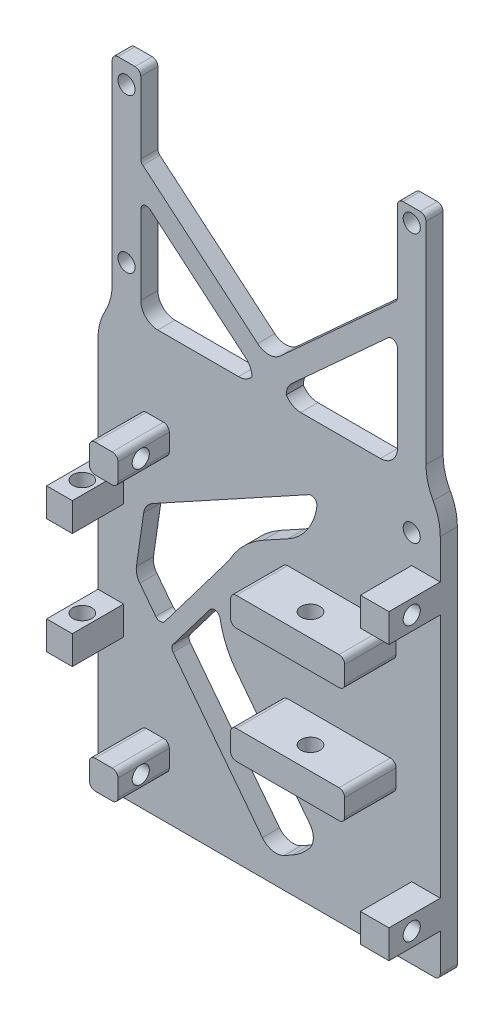
from build123d import *

# Parameters (mm, degrees)
SKETCH1_W           = 60
SKETCH1_H           = 74
BOSS_EXTRUDE1_DEPTH = 3
SKETCH2_W           = 4.5
SKETCH2_H           = 5
SKETCH2_W_2         = 20
SKETCH2_W_3         = 5
BOSS_EXTRUDE2_DEPTH = 9
SKETCH3_R           = 1.653641306
CUT_EXTRUDE1_DEPTH  = 26
SKETCH4_R           = 1.5
CUT_EXTRUDE2_DEPTH  = 59
SKETCH5_R           = 1.414139243
SKETCH5_W           = 5
SKETCH5_H           = 38
SKETCH5_R_2         = 1.5
SKETCH5_H_2         = 41
BOSS_EXTRUDE3_DEPTH = 3
SKETCH6_R           = 1.5
CUT_EXTRUDE3_DEPTH  = 3
BOSS_EXTRUDE4_DEPTH = 3
FILLET1_R           = 10
FILLET2_R           = 10
FILLET3_R           = 10
FILLET4_R           = 10
FILLET5_R           = 3
FILLET6_R           = 3
FILLET7_R           = 3
FILLET8_R           = 3
FILLET9_R           = 3
FILLET10_R          = 3
FILLET11_R          = 3
FILLET12_R          = 1
FILLET13_R          = 1
FILLET14_R          = 1
FILLET15_R          = 1
CUT_EXTRUDE4_DEPTH  = 3
FILLET16_R          = 15
FILLET17_R          = 10
FILLET18_R          = 10
FILLET19_R          = 3
FILLET20_R          = 3
FILLET21_R          = 3
FILLET22_R          = 3
FILLET23_R          = 1
FILLET24_R          = 1
FILLET25_R          = 1
FILLET26_R          = 1
FILLET27_R          = 1
FILLET28_R          = 1
FILLET29_R          = 1
BOSS_EXTRUDE5_START = -3
BOSS_EXTRUDE5_DEPTH = 3
FILLET30_R          = 1
FILLET31_R          = 1
FILLET32_R          = 1
FILLET33_R          = 1
FILLET34_R          = 1
FILLET35_R          = 1
FILLET36_R          = 1
FILLET37_R          = 1
FILLET38_R          = 1
FILLET39_R          = 1
FILLET40_R          = 1
FILLET41_R          = 1
FILLET42_R          = 1
FILLET43_R          = 1


# Some blends are built 0.0001 mm under size
with BuildPart() as part:
    # Sketch1 → Boss-Extrude1 (new body)
    with BuildSketch(Plane.XY):
        with Locations((-33.757062147, -1.04519774)):
            Rectangle(SKETCH1_W, SKETCH1_H)
    extrude(amount=BOSS_EXTRUDE1_DEPTH)

    # Sketch2 → Boss-Extrude2 (add)
    with BuildSketch(Plane.XY.offset(3)):
        with Locations((-61.507062147, 9.05480226)):
            Rectangle(SKETCH2_W, SKETCH2_H)
        with Locations((-61.507062147, -11.14519774)):
            Rectangle(SKETCH2_W, SKETCH2_H)
        with Locations((-21.507062147, -11.14519774)):
            Rectangle(SKETCH2_W_2, SKETCH2_H)
        with Locations((-21.507062147, 9.05480226)):
            Rectangle(SKETCH2_W_2, SKETCH2_H)
        with Locations((-53.757062147, -28.04519774)):
            Rectangle(SKETCH2_W_3, SKETCH2_H)
        with Locations((-53.757062147, 19.95480226)):
            Rectangle(SKETCH2_W_3, SKETCH2_H)
        with Locations((-6.257062147, -28.04519774)):
            Rectangle(SKETCH2_W_3, SKETCH2_H)
        with Locations((-6.257062147, 19.95480226)):
            Rectangle(SKETCH2_W_3, SKETCH2_H)
    extrude(amount=BOSS_EXTRUDE2_DEPTH)

    # Sketch3 → Cut-Extrude1 (cut)
    with BuildSketch(Plane.XZ.offset(13.64519774)):
        with Locations(Location((-21.507062147, 8, 0), (0, 0, 270))):
            Circle(SKETCH3_R)
        with Locations(Location((-61.507062147, 8, 0), (0, 0, 270))):
            Circle(SKETCH3_R)
    extrude(amount=-CUT_EXTRUDE1_DEPTH, mode=Mode.SUBTRACT)

    # Sketch4 → Cut-Extrude2 (cut)
    with BuildSketch(Plane.ZY.offset(56.257062147)):
        with Locations((8, 19.95480226)):
            Circle(SKETCH4_R)
        with Locations((8, -28.04519774)):
            Circle(SKETCH4_R)
    extrude(amount=-CUT_EXTRUDE2_DEPTH, mode=Mode.SUBTRACT)

    # Sketch5 → Boss-Extrude3 (add)
    # profile 1 of 3: a face of its own
    with BuildSketch(Plane.XY.offset(3)):
        with Locations((-8.757062147, 27.45480226)):
            Circle(SKETCH5_R)
    # profile 2 of 3: a face of its own
    with BuildSketch(Plane.XY.offset(3)):
        with Locations((-58.757062147, 54.95480226)):
            Rectangle(SKETCH5_W, SKETCH5_H)
        with Locations((-58.757062147, 70.45480226)):
            Circle(SKETCH5_R_2, mode=Mode.SUBTRACT)
        with Locations((-58.757062147, 43.45480226)):
            Circle(SKETCH5_R_2, mode=Mode.SUBTRACT)
    # profile 3 of 3: a face of its own
    with BuildSketch(Plane.XY.offset(3)):
        with Locations((-8.757062147, 56.45480226)):
            Rectangle(SKETCH5_W, SKETCH5_H_2)
        with Locations((-8.757062147, 74.45480226)):
            Circle(SKETCH5_R_2, mode=Mode.SUBTRACT)
    extrude(amount=-BOSS_EXTRUDE3_DEPTH)

    # Sketch6 → Cut-Extrude3 (cut)
    with BuildSketch(Plane.XY.offset(3)):
        with Locations((-8.757062147, 27.45480226)):
            Circle(SKETCH6_R)
    extrude(amount=-CUT_EXTRUDE3_DEPTH, mode=Mode.SUBTRACT)

    # Sketch7 → Boss-Extrude4 (add)
    with BuildSketch(Plane.XY.offset(3)):
        Polygon((-56.257062147, 54.95480226), (-36.757062147, 38.488135593), (-36.757062147, 35.95480226), (-30.757062147, 35.95480226), (-30.757062147, 38.688135593), (-11.257062147, 56.45480226), (-11.257062147, 61.45480226), (-33.757062147, 40.95480226), (-56.257062147, 59.95480226), align=None)
    extrude(amount=-BOSS_EXTRUDE4_DEPTH)

    # Fillet1
    # the kernel refuses this fillet: 10 mm, written as the material it takes off along each edge
    with BuildSketch(Plane(origin=(-3.757062147, 35.95480226, -16.535945694), x_dir=(0, -1, 0), z_dir=(0, 0, 1))) as fillet1_piece_1:
        with BuildLine():
            CenterArc((6.614378278, -10), FILLET1_R, 90, 41.409622109)
            Line((0, -2.5), (-0.132287566, -2.35))
            ThreePointArc((-0.132287566, -2.35), (-0.2, -1.25), (-0.2, 0))
            Line((-0.2, 0), (0, 0.2))
            Line((0, 0.2), (6.614378278, 0.2))
            Line((6.614378278, 0.2), (6.614378278, 0))
        make_face()
    extrude(amount=36.071891388, mode=Mode.SUBTRACT)

    # Fillet2
    # the kernel refuses this fillet: 10 mm, written as the material it takes off along each edge
    with BuildSketch(Plane(origin=(-63.757062147, 35.95480226, -16.535945694), x_dir=(1, 0, 0), z_dir=(0, 0, 1))) as fillet2_piece_1:
        with BuildLine():
            CenterArc((10, -6.614378278), FILLET2_R, 138.590377891, 41.409622109)
            Line((0, -6.614378278), (-0.2, -6.614378278))
            Line((-0.2, -6.614378278), (-0.2, 0))
            Line((-0.2, 0), (0, 0.2))
            ThreePointArc((0, 0.2), (1.25, 0.2), (2.35, 0.132287566))
            Line((2.35, 0.132287566), (2.5, 0))
        make_face()
    extrude(amount=36.071891388, mode=Mode.SUBTRACT)

    # Fillet3
    fillet3_edges = [part.edges().sort_by_distance(p)[0] for p in [
        (-6.257062147, 35.95480226, 1.5),
    ]]
    fillet(fillet3_edges, radius=FILLET3_R)

    # Fillet4
    fillet4_edges = [part.edges().sort_by_distance(p)[0] for p in [
        (-61.257062147, 35.95480226, 1.5),
    ]]
    fillet(fillet4_edges, radius=FILLET4_R)

    # Fillet5
    fillet5_edges = [part.edges().sort_by_distance(p)[0] for p in [
        (-33.757062147, 40.95480226, 1.5),
    ]]
    fillet(fillet5_edges, radius=FILLET5_R)

    # Fillet6
    fillet6_edges = [part.edges().sort_by_distance(p)[0] for p in [
        (-30.757062147, 38.688135593, 1.5),
    ]]
    fillet(fillet6_edges, radius=FILLET6_R)

    # Fillet7
    # the kernel refuses this fillet: 3 mm, written as the material it adds along each edge
    with BuildSketch(Plane(origin=(-30.757062147, 35.95480226, 3), x_dir=(0, 1, 0), z_dir=(0, 0, -1))) as fillet7_piece_1:
        with BuildLine():
            CenterArc((3, 2.542870165), FILLET7_R, 180, 57.95410925)
            Line((0, 2.542870165), (-0.06, 2.542870165))
            Line((-0.06, 2.542870165), (-0.06, 0))
            Line((-0.06, 0), (0, -0.06))
            ThreePointArc((0, -0.06), (0.704102499, -0.06), (1.376369099, -0.050857403))
            Line((1.376369099, -0.050857403), (1.408204999, 0))
        make_face()
    extrude(amount=3)

    # Fillet8
    fillet8_edges = [part.edges().sort_by_distance(p)[0] for p in [
        (-36.757062147, 38.488135593, 1.5),
    ]]
    fillet(fillet8_edges, radius=FILLET8_R)

    # Fillet9
    # the kernel refuses this fillet: 3 mm, written as the material it adds along each edge
    with BuildSketch(Plane(origin=(-36.757062147, 35.95480226, 3), x_dir=(0, 1, 0), z_dir=(0, 0, -1))) as fillet9_piece_1:
        with BuildLine():
            CenterArc((3, -2.353899339), FILLET9_R, 128.313241578, 51.686758422)
            Line((0, -2.353899339), (-0.06, -2.353899339))
            Line((-0.06, -2.353899339), (-0.06, 0))
            Line((-0.06, 0), (0, 0.06))
            ThreePointArc((0, 0.06), (0.570059424, 0.06), (1.102921224, 0.047077987))
            Line((1.102921224, 0.047077987), (1.140118847, 0))
        make_face()
    extrude(amount=3)

    # Fillet10
    fillet10_edges = [part.edges().sort_by_distance(p)[0] for p in [
        (-11.257062147, 35.95480226, 1.5),
    ]]
    fillet(fillet10_edges, radius=FILLET10_R)

    # Fillet11
    fillet11_edges = [part.edges().sort_by_distance(p)[0] for p in [
        (-56.257062147, 35.95480226, 1.5),
    ]]
    fillet(fillet11_edges, radius=FILLET11_R)

    # Fillet12
    fillet12_edges = [part.edges().sort_by_distance(p)[0] for p in [
        (-56.257062147, 54.95480226, 1.5),
    ]]
    fillet(fillet12_edges, radius=FILLET12_R)

    # Fillet13
    fillet13_edges = [part.edges().sort_by_distance(p)[0] for p in [
        (-11.257062147, 56.45480226, 1.5),
    ]]
    fillet(fillet13_edges, radius=FILLET13_R)

    # Fillet14
    fillet14_edges = [part.edges().sort_by_distance(p)[0] for p in [
        (-11.257062147, 61.45480226, 1.5),
    ]]
    fillet(fillet14_edges, radius=FILLET14_R)

    # Fillet15
    fillet15_edges = [part.edges().sort_by_distance(p)[0] for p in [
        (-56.257062147, 59.95480226, 1.5),
    ]]
    fillet(fillet15_edges, radius=FILLET15_R)

    # Sketch8 → Cut-Extrude4 (cut)
    with BuildSketch(Plane.XY.offset(3)):
        Polygon((-50.116582639, 4.866717107), (-25.396013769, -27.306246118), (-13.854770974, -23.267447116), (-33.369627873, -33.984622662), (-57.202223999, -3.052529118), (-55.535014268, 8.409537787), (-25.31612605, 25.005156783), (-22.56578506, 19.997073207), (-47.190918934, 6.473434066), align=None)
    extrude(amount=-CUT_EXTRUDE4_DEPTH, mode=Mode.SUBTRACT)

    # Fillet16
    fillet16_edges = [part.edges().sort_by_distance(p)[0] for p in [
        (-50.116582639, 4.866717107, 1.5),
    ]]
    fillet(fillet16_edges, radius=FILLET16_R)

    # Fillet17
    # the kernel refuses this fillet: 10 mm, written as the material it adds along each edge
    with BuildSketch(Plane(origin=(-22.56578506, 19.997073207, 3), x_dir=(-0.8765191140584714, -0.4813670560914535, 0), z_dir=(0, 0, -1))) as fillet17_piece_1:
        with BuildLine():
            CenterArc((9.034755881, 10), FILLET17_R, 205.381253351, 64.618746649)
            Line((0, 5.713604525), (-0.180695118, 5.627876616))
            ThreePointArc((-0.180695118, 5.627876616), (-0.2, 2.856802263), (-0.2, 0))
            Line((-0.2, 0), (0, -0.2))
            Line((0, -0.2), (9.034755881, -0.2))
            Line((9.034755881, -0.2), (9.034755881, 0))
        make_face()
    extrude(amount=3)

    # Fillet18
    # the kernel refuses this fillet: 10 mm, written as the material it adds along each edge
    with BuildSketch(Plane(origin=(-13.854770974, -23.267447116, 3), x_dir=(-0.8765191140584717, -0.48136705609145286, 0), z_dir=(0, 0, -1))) as fillet18_piece_1:
        with BuildLine():
            CenterArc((18.080862073, 10), FILLET18_R, 232.982441633, 37.017558367)
            Line((12.060264695, 2.015489545), (0, 0))
            Line((0, 0), (18.080862073, 0))
        make_face()
    extrude(amount=3)

    # Fillet19
    fillet19_edges = [part.edges().sort_by_distance(p)[0] for p in [
        (-33.369627873, -33.984622662, 1.5),
    ]]
    fillet(fillet19_edges, radius=FILLET19_R)

    # Fillet20
    fillet20_edges = [part.edges().sort_by_distance(p)[0] for p in [
        (-25.396013769, -27.306246118, 1.5),
    ]]
    fillet(fillet20_edges, radius=FILLET20_R)

    # Fillet21
    fillet21_edges = [part.edges().sort_by_distance(p)[0] for p in [
        (-55.535014268, 8.409537787, 1.5),
    ]]
    fillet(fillet21_edges, radius=FILLET21_R)

    # Fillet22
    fillet22_edges = [part.edges().sort_by_distance(p)[0] for p in [
        (-57.202223999, -3.052529118, 1.5),
    ]]
    fillet(fillet22_edges, radius=FILLET22_R)

    # Fillet23
    fillet23_edges = [part.edges().sort_by_distance(p)[0] for p in [
        (-25.31612605, 25.005156783, 1.5),
    ]]
    fillet(fillet23_edges, radius=FILLET23_R)

    # Fillet24
    fillet24_edges = [part.edges().sort_by_distance(p)[0] for p in [
        (-3.757062147, -38.04519774, 1.5),
    ]]
    fillet(fillet24_edges, radius=FILLET24_R)

    # Fillet25
    fillet25_edges = [part.edges().sort_by_distance(p)[0] for p in [
        (-63.757062147, -38.04519774, 1.5),
    ]]
    fillet(fillet25_edges, radius=FILLET25_R)

    # Fillet26
    fillet26_edges = [part.edges().sort_by_distance(p)[0] for p in [
        (-6.257062147, 76.95480226, 1.5),
    ]]
    fillet(fillet26_edges, radius=FILLET26_R)

    # Fillet27
    fillet27_edges = [part.edges().sort_by_distance(p)[0] for p in [
        (-11.257062147, 76.95480226, 1.5),
    ]]
    fillet(fillet27_edges, radius=FILLET27_R)

    # Fillet28
    fillet28_edges = [part.edges().sort_by_distance(p)[0] for p in [
        (-56.257062147, 73.95480226, 1.5),
    ]]
    fillet(fillet28_edges, radius=FILLET28_R)

    # Fillet29
    fillet29_edges = [part.edges().sort_by_distance(p)[0] for p in [
        (-61.257062147, 73.95480226, 1.5),
    ]]
    fillet(fillet29_edges, radius=FILLET29_R)

    # Sketch9 → Boss-Extrude5 (add)
    with BuildSketch(Plane.XY.offset(3).offset(BOSS_EXTRUDE5_START)):
        with BuildLine():
            Line((-52.826705341, -8.731472014), (-40.816714821, 7.168272022))
            ThreePointArc((-40.816714821, 7.168272022), (-42.122406295, 3.760204715), (-42.566398062, 0.13768842))
            Line((-42.566398062, 0.13768842), (-51.052754902, -11.033864947))
            Line((-51.052754902, -11.033864947), (-52.826705341, -8.731472014))
        make_face()
    extrude(amount=BOSS_EXTRUDE5_DEPTH)

    # Fillet30
    fillet30_edges = [part.edges().sort_by_distance(p)[0] for p in [
        (-51.052754902, -11.033864947, 1.5),
    ]]
    fillet(fillet30_edges, radius=FILLET30_R)

    # Fillet31
    fillet31_edges = [part.edges().sort_by_distance(p)[0] for p in [
        (-52.826705341, -8.731472014, 1.5),
    ]]
    fillet(fillet31_edges, radius=FILLET31_R)

    # Fillet32
    fillet32_edges = [part.edges().sort_by_distance(p)[0] for p in [
        (-42.566398062, 0.13768842, 1.5),
    ]]
    fillet(fillet32_edges, radius=FILLET32_R)

    # Fillet33
    fillet33_edges = [part.edges().sort_by_distance(p)[0] for p in [
        (-11.507062147, 6.55480226, 7.5),
    ]]
    fillet(fillet33_edges, radius=FILLET33_R)

    # Fillet34
    fillet34_edges = [part.edges().sort_by_distance(p)[0] for p in [
        (-11.507062147, 11.55480226, 7.5),
    ]]
    fillet(fillet34_edges, radius=FILLET34_R)

    # Fillet35
    fillet35_edges = [part.edges().sort_by_distance(p)[0] for p in [
        (-31.507062147, 6.55480226, 7.5),
    ]]
    fillet(fillet35_edges, radius=FILLET35_R)

    # Fillet36
    fillet36_edges = [part.edges().sort_by_distance(p)[0] for p in [
        (-31.507062147, 11.55480226, 7.5),
    ]]
    fillet(fillet36_edges, radius=FILLET36_R)

    # Fillet37
    fillet37_edges = [part.edges().sort_by_distance(p)[0] for p in [
        (-11.507062147, -13.64519774, 7.5),
    ]]
    fillet(fillet37_edges, radius=FILLET37_R)

    # Fillet38
    fillet38_edges = [part.edges().sort_by_distance(p)[0] for p in [
        (-11.507062147, -8.64519774, 7.5),
    ]]
    fillet(fillet38_edges, radius=FILLET38_R)

    # Fillet39
    fillet39_edges = [part.edges().sort_by_distance(p)[0] for p in [
        (-31.507062147, -13.64519774, 7.5),
    ]]
    fillet(fillet39_edges, radius=FILLET39_R)

    # Fillet40
    fillet40_edges = [part.edges().sort_by_distance(p)[0] for p in [
        (-31.507062147, -8.64519774, 7.5),
    ]]
    fillet(fillet40_edges, radius=FILLET40_R)

    # Fillet41
    fillet41_edges = [part.edges().sort_by_distance(p)[0] for p in [
        (-51.257062147, -30.54519774, 7.5),
    ]]
    fillet(fillet41_edges, radius=FILLET41_R - 0.0001)  # a hair under: the kernel refuses the full size

    # Fillet42
    fillet42_edges = [part.edges().sort_by_distance(p)[0] for p in [
        (-56.257062147, -30.54519774, 7.5),
    ]]
    fillet(fillet42_edges, radius=FILLET42_R - 0.0001)  # a hair under: the kernel refuses the full size

    # Fillet43
    fillet43_edges = [part.edges().sort_by_distance(p)[0] for p in [
        (-51.257062147, -25.54519774, 7.5),
        (-56.257062147, -25.54519774, 7.5),
        (-51.257062147, 17.45480226, 7.5),
        (-51.257062147, 22.45480226, 7.5),
        (-56.257062147, 22.45480226, 7.5),
        (-56.257062147, 17.45480226, 7.5),
    ]]
    fillet(fillet43_edges, radius=FILLET43_R - 0.0001)  # a hair under: the kernel refuses the full size


solid = part.part
